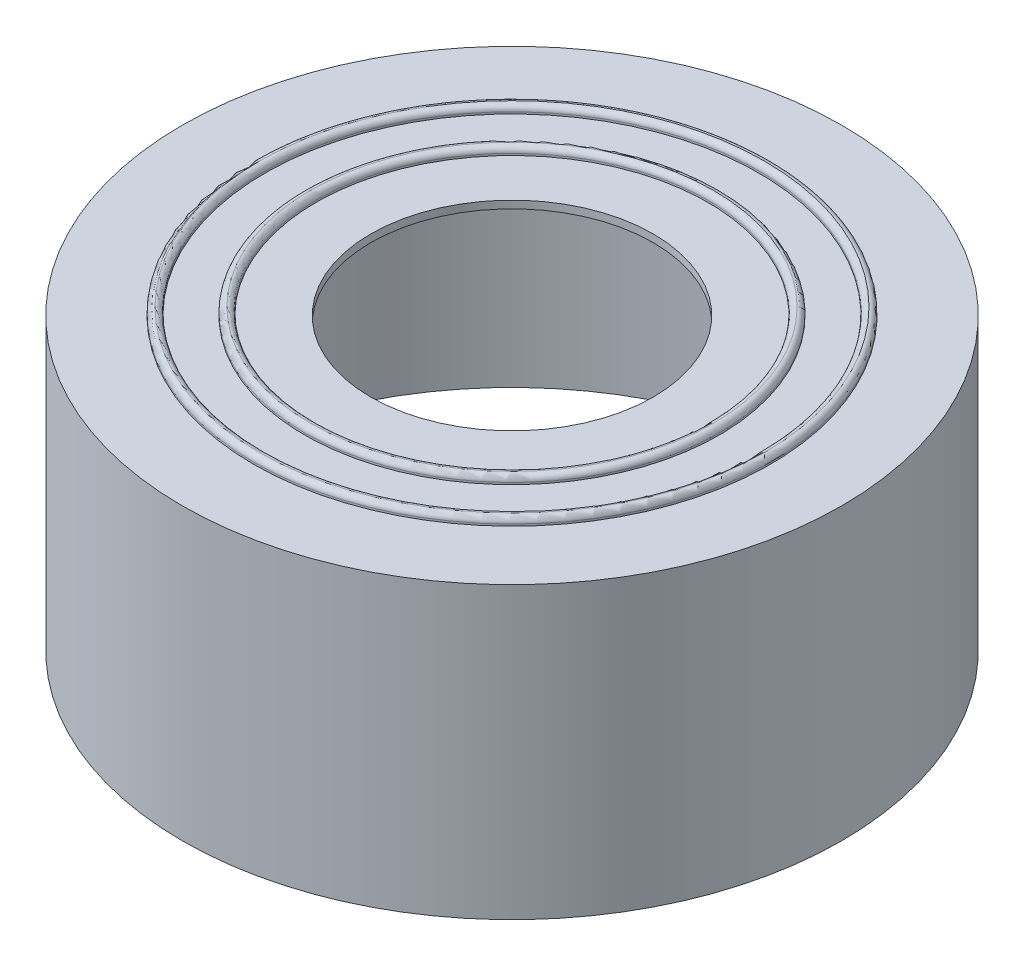
from build123d import *

# Parameters (mm, degrees)
SKETCH_1_R        = 68.5
SKETCH_1_R_2      = 65.5
EXTRUDE_1_DEPTH   = 2
SKETCH_1_R_3      = 55
SKETCH_1_R_4      = 52
EXTRUDE_1_2_DEPTH = 2
SKETCH_2_R        = 87.5
SKETCH_2_R_2      = 37.5
EXTRUDE_2_DEPTH   = 2
SKETCH_3_R        = 87.5
SKETCH_3_R_2      = 85.5
EXTRUDE_3_DEPTH   = 75
FILLET_1_R        = 1.5


with BuildPart() as part:
    # 草图1 → 凸台-拉伸1 (new body)
    with BuildSketch(Plane(origin=(0, 0, 0), x_dir=(1, 0, 0), z_dir=(0, 1, 0))):
        with Locations(Location((0, 0, 0), (0, 0, 270))):
            Circle(SKETCH_1_R)
        with Locations(Location((0, 0, 0), (0, 0, 270))):
            Circle(SKETCH_1_R_2, mode=Mode.SUBTRACT)
    extrude(amount=EXTRUDE_1_DEPTH)



with BuildPart() as body_2:
    # 草图1 → Extrude 1 2 (new body)
    with BuildSketch(Plane(origin=(0, 0, 0), x_dir=(1, 0, 0), z_dir=(0, 1, 0))):
        with Locations(Location((0, 0, 0), (0, 0, 270))):
            Circle(SKETCH_1_R_3)
        with Locations(Location((0, 0, 0), (0, 0, 270))):
            Circle(SKETCH_1_R_4, mode=Mode.SUBTRACT)
    extrude(amount=EXTRUDE_1_2_DEPTH)


with BuildPart() as part_1:
    add(part.part)

    add(body_2.part)  # 凸台-拉伸2 merges body 2
    # 草图2 → 凸台-拉伸2 (add)
    with BuildSketch(Plane.XZ):
        with Locations(Location((0, 0, 0), (0, 0, 270))):
            Circle(SKETCH_2_R)
        with Locations(Location((0, 0, 0), (0, 0, 270))):
            Circle(SKETCH_2_R_2, mode=Mode.SUBTRACT)
    extrude(amount=EXTRUDE_2_DEPTH)

    # 草图3 → 凸台-拉伸3 (add)
    with BuildSketch(Plane.XZ.offset(2)):
        with Locations(Location((0, 0, 0), (0, 0, 270))):
            Circle(SKETCH_3_R)
        with Locations(Location((0, 0, 0), (0, 0, 270))):
            Circle(SKETCH_3_R_2, mode=Mode.SUBTRACT)
    extrude(amount=EXTRUDE_3_DEPTH)

    # 圆角1
    fillet_1_edges = [part_1.edges().sort_by_distance(p)[0] for p in [
        (0, 2, -68.5),
        (0, 2, -52),
        (0, 2, -55),
        (0, 2, -65.5),
    ]]
    fillet(fillet_1_edges, radius=FILLET_1_R - 0.0001)  # a hair under: the kernel refuses the full size


solid = part_1.part
